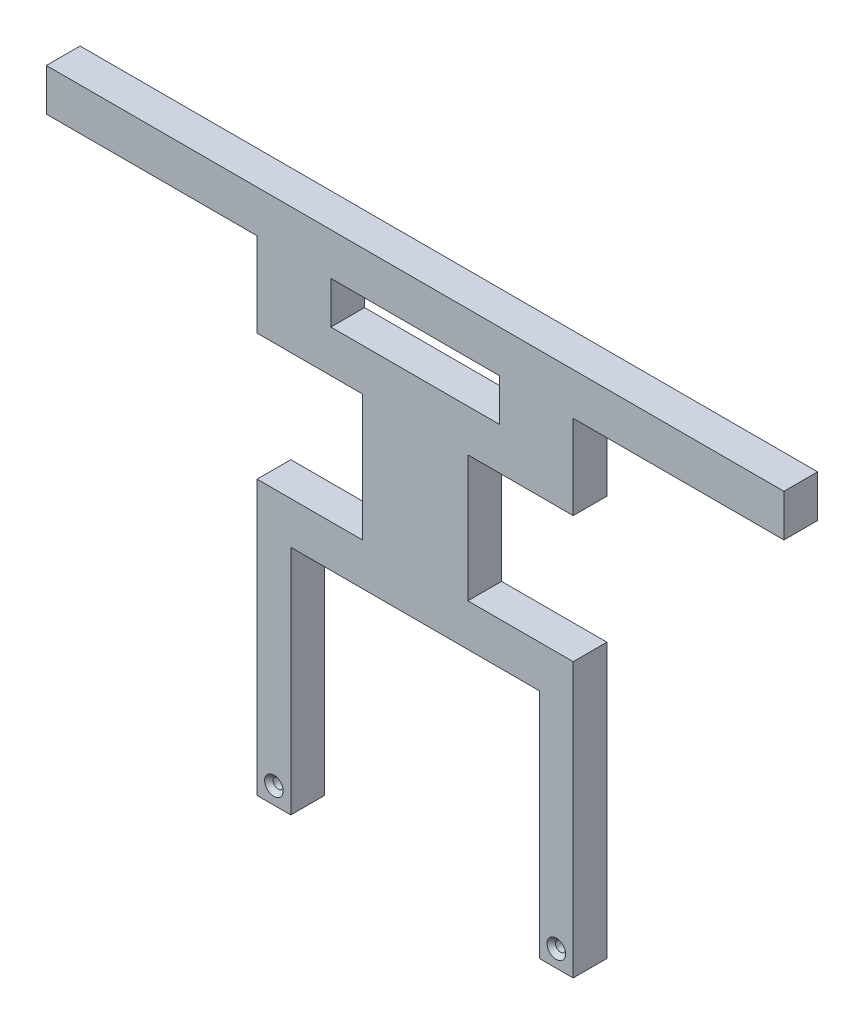
from build123d import *

# Parameters (mm, degrees)
BOSS_EXTRU_1_DEPTH                             = 8
FRAISAGE_POUR_VIS_T_TE_FRAIS_E_M21_D           = 2.4
FRAISAGE_POUR_VIS_T_TE_FRAIS_E_M21_CSINK_D     = 4.4
FRAISAGE_POUR_VIS_T_TE_FRAIS_E_M21_CSINK_ANGLE = 90


with BuildPart() as part:
    # Esquisse1 → Boss.-Extru.1 (new body)
    with BuildSketch(Plane.XY):
        Polygon((0, 0), (0, 65), (25, 65), (25, 95), (0, 95), (0, 115), (-50, 115), (-50, 125), (37.5, 125), (37.5, 115), (17.5, 115), (17.5, 105), (37.5, 105), (37.5, 55), (8, 55), (8, 0), align=None)
    boss_extru_1 = extrude(amount=BOSS_EXTRU_1_DEPTH)

    # Symétrie1: Boss.-Extru.1 across plane
    add(boss_extru_1.mirror(Plane(origin=(37.5, 105, 8), x_dir=(0, 0, 1), z_dir=(-1, 0, 0))))

    # Fraisage pour vis à tête fraisée M21 (through all)
    with Locations(Plane.XY.offset(8)):
        with Locations((4, 4), (71, 4)):
            CounterSinkHole(FRAISAGE_POUR_VIS_T_TE_FRAIS_E_M21_D / 2, FRAISAGE_POUR_VIS_T_TE_FRAIS_E_M21_CSINK_D / 2, counter_sink_angle=FRAISAGE_POUR_VIS_T_TE_FRAIS_E_M21_CSINK_ANGLE)


solid = part.part
